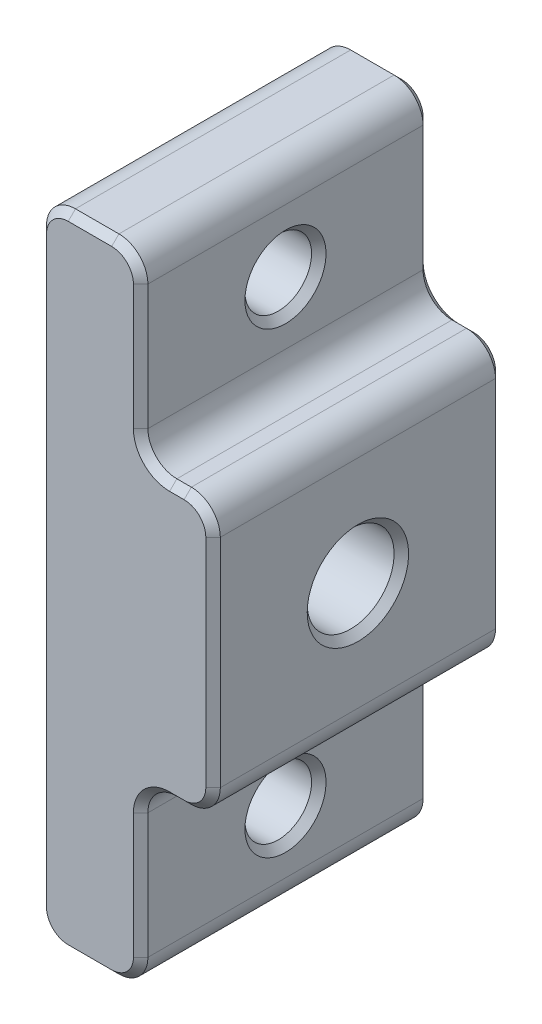
from build123d import *

# Parameters (mm, degrees)
AUFSATZ_LINEAR_AUSTRAGEN1_DEPTH = 20
SKIZZE2_R                       = 3
SCHNITT_LINEAR_AUSTRAGEN1_DEPTH = 20
SKIZZE3_R                       = 5.25
SCHNITT_LINEAR_AUSTRAGEN2_DEPTH = 6.55
SKIZZE4_R                       = 2.3
SCHNITT_LINEAR_AUSTRAGEN3_DEPTH = 10
VERRUNDUNG1_R                   = 2
FASE1_SIZE                      = 0.5


with BuildPart() as part:
    # Skizze1 → Aufsatz-Linear austragen1 (new body)
    with BuildSketch(Plane.XY):
        Polygon((0, -22.130332374), (0, 22.130332374), (7, 22.130332374), (7, 9.485781443), (12, 9.485781443), (12, -9.485781443), (7, -9.485781443), (7, -22.130332374), align=None)
    extrude(amount=AUFSATZ_LINEAR_AUSTRAGEN1_DEPTH)

    # Skizze2 → Schnitt-Linear austragen1 (cut)
    with BuildSketch(Plane(origin=(12, 0, 0), x_dir=(0, 0, -1), z_dir=(1, 0, 0))):
        with Locations((-10, 0)):
            Circle(SKIZZE2_R)
    extrude(amount=-SCHNITT_LINEAR_AUSTRAGEN1_DEPTH, mode=Mode.SUBTRACT)

    # Skizze3 → Schnitt-Linear austragen2 (cut)
    with BuildSketch(Plane.ZY):
        with Locations((10, 0)):
            Circle(SKIZZE3_R)
    extrude(amount=-SCHNITT_LINEAR_AUSTRAGEN2_DEPTH, mode=Mode.SUBTRACT)

    # Skizze4 → Schnitt-Linear austragen3 (cut)
    with BuildSketch(Plane(origin=(7, 0, 0), x_dir=(0, 0, -1), z_dir=(1, 0, 0))):
        with Locations((-10, -15.808056909)):
            Circle(SKIZZE4_R)
        with Locations((-10, 15.808056909)):
            Circle(SKIZZE4_R)
    extrude(amount=-SCHNITT_LINEAR_AUSTRAGEN3_DEPTH, mode=Mode.SUBTRACT)

    # Verrundung1
    verrundung1_edges = [part.edges().sort_by_distance(p)[0] for p in [
        (0, 22.130332374, 10),
        (7, -9.485781443, 10),
        (7, 22.130332374, 10),
        (7, 9.485781443, 10),
        (12, 9.485781443, 10),
        (12, -9.485781443, 10),
        (7, -22.130332374, 10),
        (0, -22.130332374, 10),
    ]]
    fillet(verrundung1_edges, radius=VERRUNDUNG1_R)

    # Fase1
    fase1_edges = [part.edges().sort_by_distance(p)[0] for p in [
        (0, 15.808056909, 12.3),
        (7, 15.808056909, 12.3),
        (6.55, 0, 13),
        (12, 0, 13),
        (0, -15.808056909, 12.3),
        (7, -15.808056909, 12.3),
        (7, -15.808056909, 20),
        (3.5, -22.130332374, 20),
        (0, 0, 20),
        (3.5, 22.130332374, 20),
        (7, 15.808056909, 20),
        (9.5, 9.485781443, 20),
        (12, 0, 20),
        (9.5, -9.485781443, 20),
        (12, 0, 0),
        (9.5, 9.485781443, 0),
        (7, 15.808056909, 0),
        (3.5, 22.130332374, 0),
        (0, 0, 0),
        (3.5, -22.130332374, 0),
        (7, -15.808056909, 0),
        (9.5, -9.485781443, 0),
        (0, 0, 4.75),
        (6.414213562, 21.544545937, 20),
        (7.585786438, 10.071567881, 20),
        (11.414213562, 8.899995006, 20),
        (11.414213562, -8.899995006, 20),
        (7.585786438, -10.071567881, 20),
        (6.414213562, -21.544545937, 20),
        (0.585786438, -21.544545937, 20),
        (0.585786438, 21.544545937, 20),
        (0.585786438, -21.544545937, 0),
        (6.414213562, -21.544545937, 0),
        (7.585786438, -10.071567881, 0),
        (11.414213562, -8.899995006, 0),
        (11.414213562, 8.899995006, 0),
        (7.585786438, 10.071567881, 0),
        (6.414213562, 21.544545937, 0),
        (0.585786438, 21.544545937, 0),
    ]]
    chamfer(fase1_edges, length=FASE1_SIZE)


solid = part.part
